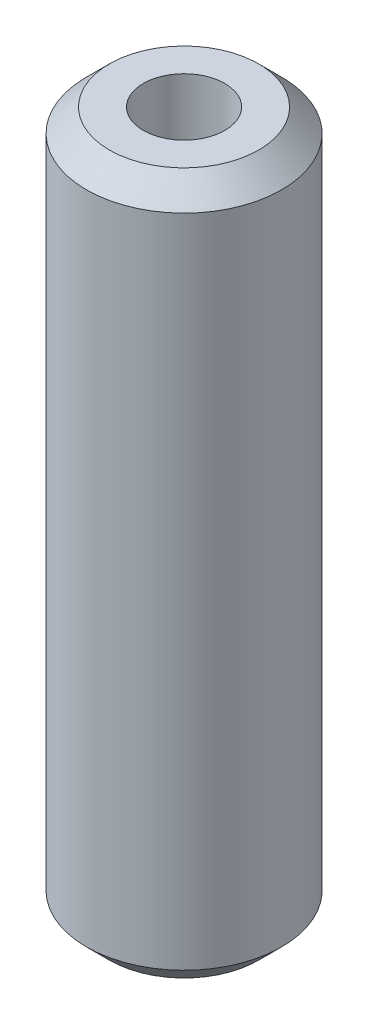
from build123d import *

# Parameters (mm, degrees)
SKETCH1_R           = 20
BOSS_EXTRUDE1_DEPTH = 143.751886313
SKETCH2_R           = 8.346233779
CUT_EXTRUDE1_DEPTH  = 147.508036703
CHAMFER1_SIZE       = 4.704679762


with BuildPart() as part:
    # Sketch1 → Boss-Extrude1 (new body)
    with BuildSketch(Plane(origin=(0, 0, 0), x_dir=(1, 0, 0), z_dir=(0, 1, 0))):
        Circle(SKETCH1_R)
    extrude(amount=BOSS_EXTRUDE1_DEPTH)

    # Sketch2 → Cut-Extrude1 (cut, through all)
    with BuildSketch(Plane(origin=(0, 0, 0), x_dir=(1, 0, 0), z_dir=(0, 1, 0))):
        Circle(SKETCH2_R)
    extrude(amount=CUT_EXTRUDE1_DEPTH, mode=Mode.SUBTRACT)

    # Chamfer1
    chamfer1_edges = [part.edges().sort_by_distance(p)[0] for p in [
        (-20, 143.751886313, 0),
        (-20, 0, 0),
    ]]
    chamfer(chamfer1_edges, length=CHAMFER1_SIZE)


solid = part.part
